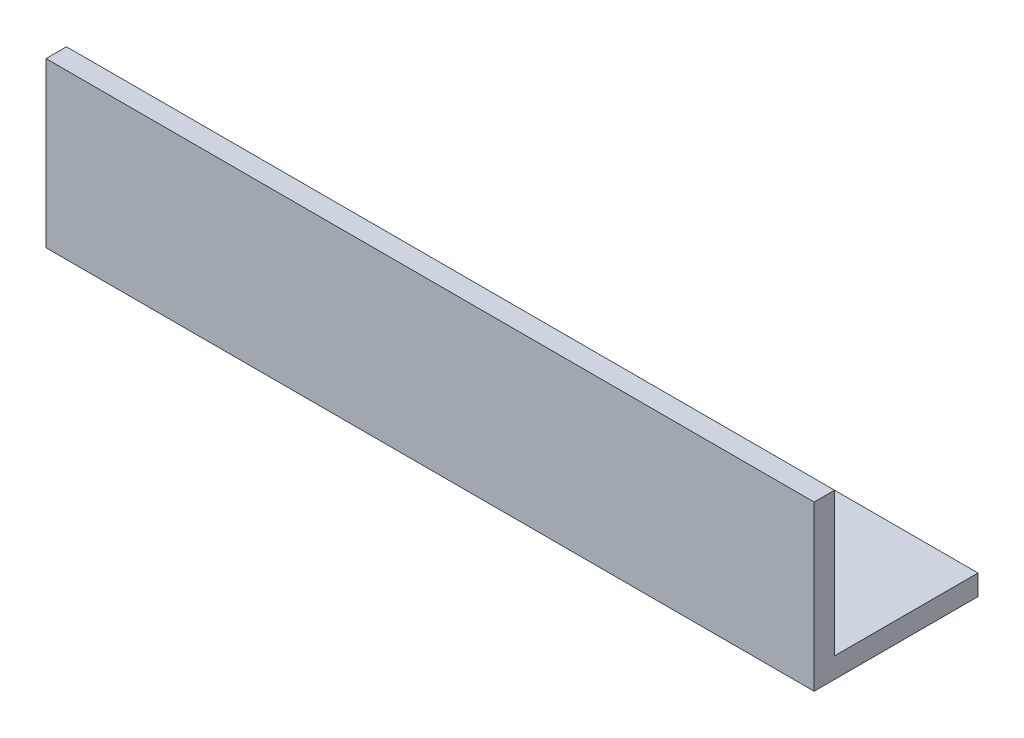
from build123d import *

# Parameters (mm, degrees)
EXTRUDE_1_DEPTH     = 150
SKETCH_2_R          = 5
CUT_EXTRUDE_1_DEPTH = 157.678013773


with BuildPart() as part:
    # Эскиз1 → Вытянуть-Тонкостенный1 (new body)
    with BuildSketch(Plane(origin=(0, 0, 0), x_dir=(0, 0, -1), z_dir=(1, 0, 0))):
        Polygon((32, 0), (0, 0), (0, 32), (4, 32), (4, 4), (32, 4), align=None)
    extrude(amount=EXTRUDE_1_DEPTH)

    # Эскиз2 → Вырез-Вытянуть1 (cut, through all)
    with BuildSketch(Plane.XZ):
        with Locations((130, -13)):
            Circle(SKETCH_2_R)
        with Locations((100, -13)):
            Circle(SKETCH_2_R)
        with Locations((50, -13)):
            Circle(SKETCH_2_R)
        with Locations((20, -13)):
            Circle(SKETCH_2_R)
    extrude(amount=-CUT_EXTRUDE_1_DEPTH, mode=Mode.SUBTRACT)


solid = part.part
